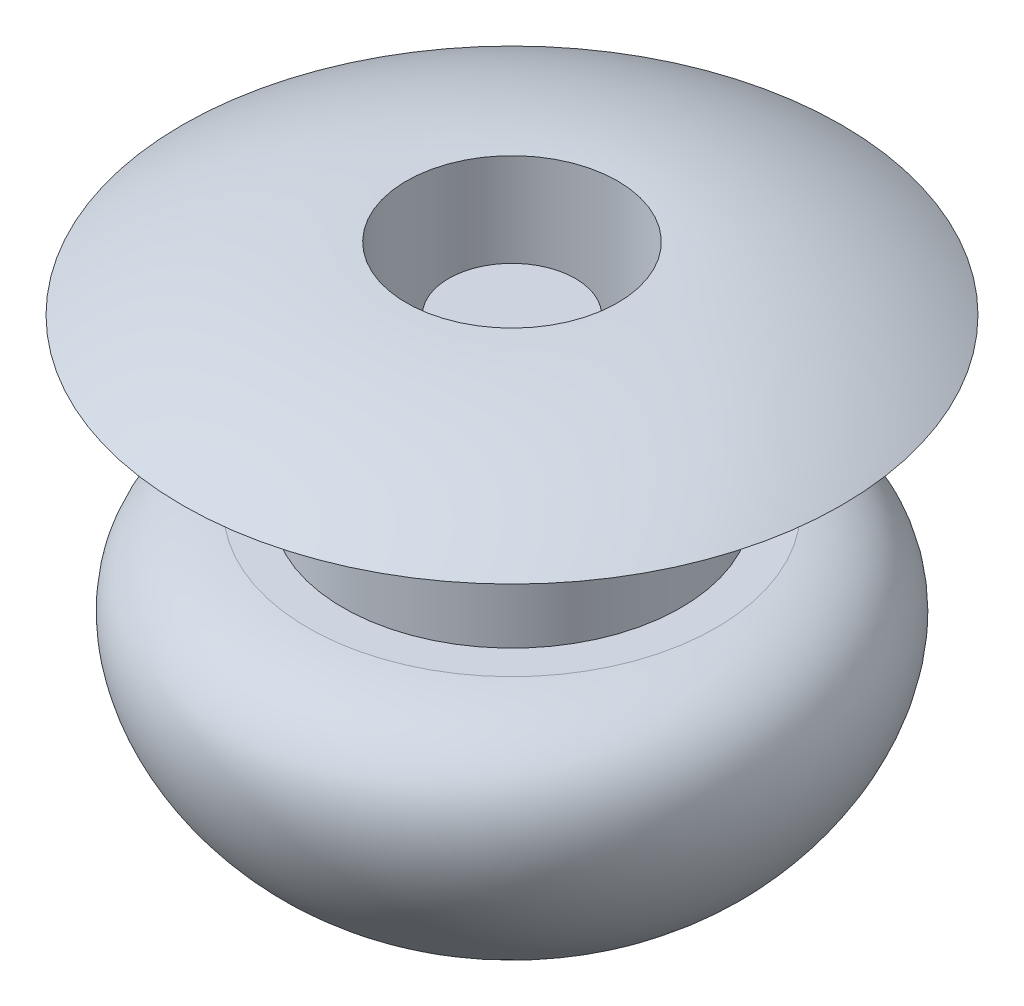
from build123d import *


with BuildPart() as part:
    # Szkic1 → Obrót1 (revolve)
    with BuildSketch(Plane(origin=(0, 0, 0), x_dir=(0, 0, -1), z_dir=(1, 0, 0))):
        with BuildLine():
            Line((0, 0), (0, -2))
            Line((0, -2), (0, -3.5))
            add(Edge.make_bspline(
                [(-0.956030427, -3.378190671), (-0.520263876, -3.5), (0, -3.5)],
                knots=[4.134444875, 4.134444875, 4.134444875, 4.71238898, 4.71238898, 4.71238898], degree=2, weights=[1, 0.958537313, 1]))
            add(Edge.make_bspline(
                [(-2.413891755, -2), (-3.858559437, -2.163296686), (-3.558358928, -4.322980362), (-0.971318098, -5.871940016), (-0.341145137, -3.79203191), (-0.956030427, -3.378190671)],
                knots=[0, 0, 0, 0, 0.454219308, 0.705200672, 1, 1, 1, 1], degree=3))
            Line((-2.413891755, -2), (-2, -2))
            Line((-2, -2), (-2, 0))
            Line((-2, 0), (-3.9, 0))
            ThreePointArc((-3.9, 0), (-2.627043935, 0.558888572), (-1.25, 0.75))
            Line((-1.25, 0.75), (-1.25, -2))
            Line((-1.25, -2), (-0.75, -2))
            Line((-0.75, -2), (-0.75, 0))
            Line((-0.75, 0), (0, 0))
        make_face()
    revolve(axis=Axis((0, 0, 0), (0, 1, 0)))


solid = part.part
